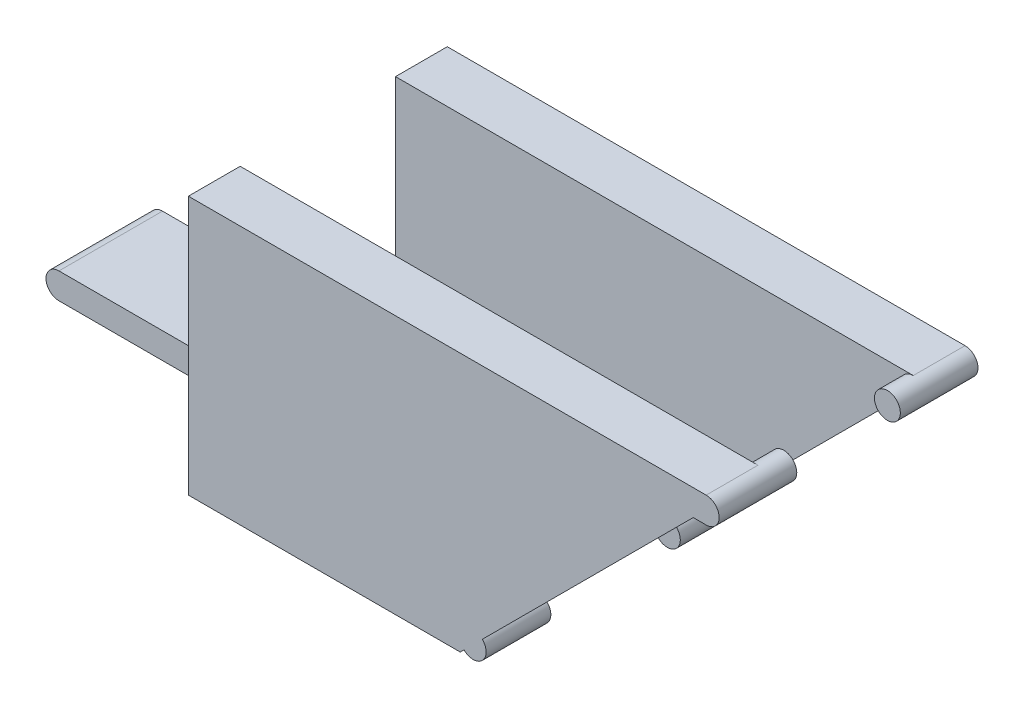
from build123d import *

# Parameters (mm, degrees)
SKETCH_1_W           = 40
SKETCH_1_H           = 20
EXTRUDE_1_DEPTH      = 20
SKETCH_2_W           = 8
SKETCH_2_H           = 4
EXTRUDE_2_DEPTH      = 16
SKETCH_4_W           = 12
SKETCH_4_H           = 18.32487869
CUT_EXTRUDE_2_DEPTH  = 46.82575695
SKETCH_7_W           = 12
SKETCH_7_H           = 4
CUT_EXTRUDE_4_DEPTH  = 20
SKETCH_5_R           = 1
EXTRUDE_3_DEPTH      = 10
SKETCH_6_W           = 8
SKETCH_6_H           = 25.038569191
CUT_EXTRUDE_3_DEPTH  = 10
CUT_EXTRUDE_8_DEPTH  = 20
SKETCH_13_R          = 1
EXTRUDE_5_DEPTH      = 8
CUT_EXTRUDE_10_DEPTH = 20
SKETCH_16_R          = 1
EXTRUDE_12_DEPTH     = 5
EXTRUDE_START        = -5
SKETCH_17_R          = 1
EXTRUDE_13_DEPTH     = 5


with BuildPart() as part:
    # 草图1 → 凸台-拉伸1 (new body)
    with BuildSketch(Plane(origin=(0, 0, 0), x_dir=(1, 0, 0), z_dir=(0, 1, 0))):
        with Locations((18, 0)):
            Rectangle(SKETCH_1_W, SKETCH_1_H)
    extrude(amount=EXTRUDE_1_DEPTH)

    # 草图2 → 凸台-拉伸2 (add)
    with BuildSketch(Plane.ZY.offset(2)):
        with Locations((0, 2)):
            Rectangle(SKETCH_2_W, SKETCH_2_H)
    extrude(amount=EXTRUDE_2_DEPTH)

    # 草图4 → 切除-拉伸2 (cut, through all)
    with BuildSketch(Plane.ZY.offset(2)):
        with Locations((0, 13.162439345)):
            Rectangle(SKETCH_4_W, SKETCH_4_H)
    extrude(amount=-CUT_EXTRUDE_2_DEPTH, mode=Mode.SUBTRACT)

    # 草图7 → 切除-拉伸4 (cut)
    with BuildSketch(Plane(origin=(38, 0, 0), x_dir=(0, 0, -1), z_dir=(1, 0, 0))):
        with Locations((0, 2)):
            Rectangle(SKETCH_7_W, SKETCH_7_H)
    extrude(amount=-CUT_EXTRUDE_4_DEPTH, mode=Mode.SUBTRACT)

    # 草图5 → 凸台-拉伸3 (add, symmetric)
    with BuildSketch(Plane.XY):
        with Locations((38, 19)):
            Circle(SKETCH_5_R)
        with Locations((38, 1)):
            Circle(SKETCH_5_R)
    extrude(amount=EXTRUDE_3_DEPTH, both=True)

    # 草图6 → 切除-拉伸3 (cut, symmetric)
    with BuildSketch(Plane(origin=(38, 0, 0), x_dir=(0, 0, -1), z_dir=(1, 0, 0))):
        with Locations((0, 10.475013396)):
            Rectangle(SKETCH_6_W, SKETCH_6_H)
    extrude(amount=CUT_EXTRUDE_3_DEPTH, both=True, mode=Mode.SUBTRACT)

    # 草图12 → 切除-拉伸8 (cut)
    with BuildSketch(Plane.XY.offset(4)):
        with BuildLine():
            Line((-5, 2), (-18.474771325, 2))
            Line((-18.474771325, 2), (-18.474771325, 0))
            Line((-18.474771325, 0), (-5, 0))
            ThreePointArc((-5, 0), (-6, 1), (-5, 2))
        make_face()
    extrude(amount=-CUT_EXTRUDE_8_DEPTH, mode=Mode.SUBTRACT)

    # 草图13 → 凸台-拉伸5 (add)
    with BuildSketch(Plane.XY.offset(4)):
        with Locations((-18, 3)):
            Circle(SKETCH_13_R)
    extrude(amount=-EXTRUDE_5_DEPTH)

    # 草图15 → 切除-拉伸10 (cut)
    with BuildSketch(Plane.XY.offset(10)):
        Polygon((19, 0), (39.887994795, 0), (38, 18), (37, 18), align=None)
    extrude(amount=-CUT_EXTRUDE_10_DEPTH, mode=Mode.SUBTRACT)

    # 草图16 → 凸台-拉伸12 (add)
    with BuildSketch(Plane.XY.offset(10)):
        with Locations((20, 1)):
            Circle(SKETCH_16_R)
    extrude(amount=-EXTRUDE_12_DEPTH)

    # 草图17 → 凸台-拉伸13 (add)
    with BuildSketch(Plane(origin=(0, 0, -10), x_dir=(-1, 0, 0), z_dir=(0, 0, -1)).offset(EXTRUDE_START)):
        with Locations((-20, 1)):
            Circle(SKETCH_17_R)
    extrude(amount=EXTRUDE_13_DEPTH)


solid = part.part
